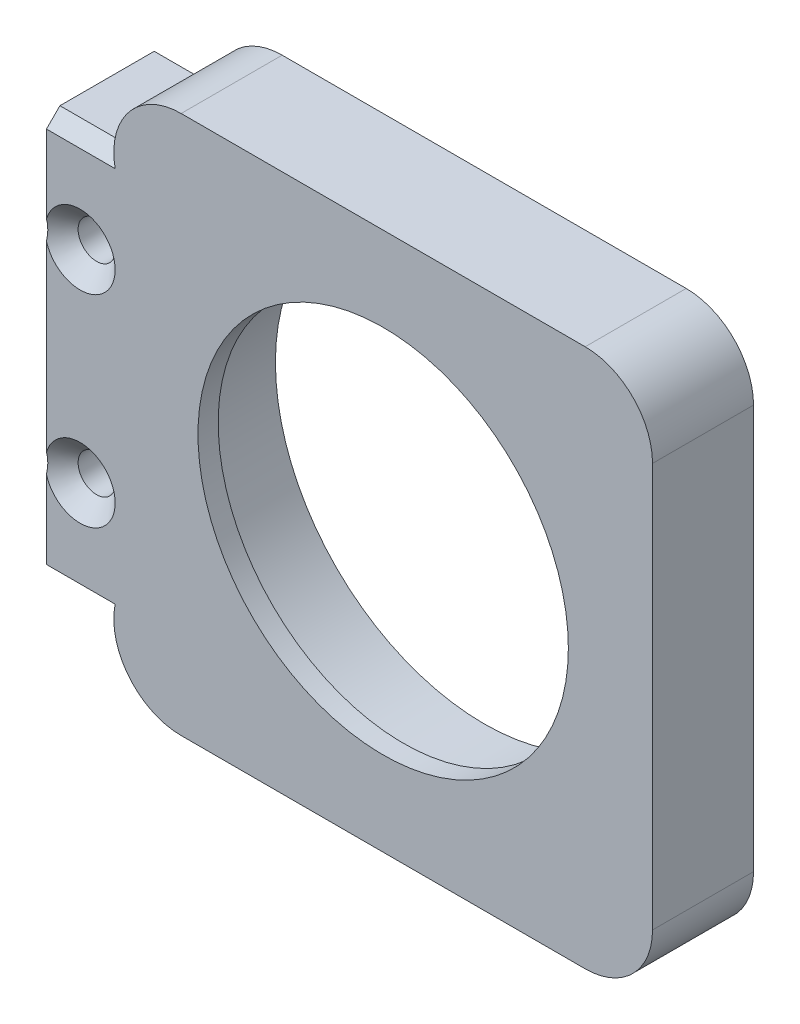
from build123d import *

# Parameters (mm, degrees)
SKETCH1_W                                       = 80
SKETCH1_H                                       = 80
BOSS_EXTRUDE1_DEPTH                             = 15
SKETCH2_R                                       = 31
CUT_EXTRUDE2_DEPTH                              = 115.127122105
SKETCH3_R                                       = 31
SKETCH3_R_2                                     = 27.5
BOSS_EXTRUDE2_DEPTH                             = 3
FILLET1_R                                       = 10
SKETCH5_W                                       = 10
SKETCH5_H                                       = 60
BOSS_EXTRUDE3_DEPTH                             = 20
SKETCH6_R                                       = 2.5
CUT_EXTRUDE3_DEPTH                              = 115.891252931
CHAMFER1_SIZE                                   = 2
CSK_FOR_M5_FLAT_HEAD_MACHINE_SCREW2_D           = 5.5
CSK_FOR_M5_FLAT_HEAD_MACHINE_SCREW2_CSINK_D     = 10.4
CSK_FOR_M5_FLAT_HEAD_MACHINE_SCREW2_CSINK_ANGLE = 90
CHAMFER2_SIZE                                   = 4
SKETCH11_R                                      = 15
CUT_EXTRUDE4_DEPTH                              = 2


with BuildPart() as part:
    # Sketch1 → Boss-Extrude1 (new body)
    with BuildSketch(Plane.XY):
        with Locations((40, 40)):
            Rectangle(SKETCH1_W, SKETCH1_H)
    extrude(amount=BOSS_EXTRUDE1_DEPTH)

    # Sketch2 → Cut-Extrude2 (cut, through all)
    with BuildSketch(Plane.XY.offset(15)):
        with Locations((40, 40)):
            Circle(SKETCH2_R)
    extrude(amount=-CUT_EXTRUDE2_DEPTH, mode=Mode.SUBTRACT)

    # Sketch3 → Boss-Extrude2 (add)
    with BuildSketch(Plane.XY.offset(15)):
        with Locations((40, 40)):
            Circle(SKETCH3_R)
        with Locations((40, 40)):
            Circle(SKETCH3_R_2, mode=Mode.SUBTRACT)
    extrude(amount=-BOSS_EXTRUDE2_DEPTH)

    # Fillet1
    fillet1_edges = [part.edges().sort_by_distance(p)[0] for p in [
        (80, 80, 7.5),
        (80, 0, 7.5),
        (0, 0, 7.5),
        (0, 80, 7.5),
    ]]
    fillet(fillet1_edges, radius=FILLET1_R)

    # Sketch5 → Boss-Extrude3 (add)
    with BuildSketch(Plane.XY.offset(15)):
        with Locations((-5, 40)):
            Rectangle(SKETCH5_W, SKETCH5_H)
    extrude(amount=-BOSS_EXTRUDE3_DEPTH)

    # Sketch6 → Cut-Extrude3 (cut, through all)
    with BuildSketch(Plane.XY.offset(15)):
        with Locations((-5, 55)):
            Circle(SKETCH6_R)
        with Locations((-5, 25)):
            Circle(SKETCH6_R)
    extrude(amount=-CUT_EXTRUDE3_DEPTH, mode=Mode.SUBTRACT)

    # Chamfer1
    chamfer1_edges = [part.edges().sort_by_distance(p)[0] for p in [
        (-5, 10, 15),
        (-5, 70, 15),
    ]]
    chamfer(chamfer1_edges, length=CHAMFER1_SIZE)

    # CSK for M5 Flat Head Machine Screw2 (through all)
    with Locations(Plane.XY.offset(15)):
        with Locations((-5, 55), (-5, 25)):
            CounterSinkHole(CSK_FOR_M5_FLAT_HEAD_MACHINE_SCREW2_D / 2, CSK_FOR_M5_FLAT_HEAD_MACHINE_SCREW2_CSINK_D / 2, counter_sink_angle=CSK_FOR_M5_FLAT_HEAD_MACHINE_SCREW2_CSINK_ANGLE)

    # Chamfer2
    chamfer2_edges = [part.edges().sort_by_distance(p)[0] for p in [
        (-5, 10, -5),
        (-5, 70, -5),
    ]]
    chamfer(chamfer2_edges, length=CHAMFER2_SIZE)

    # Sketch11 → Cut-Extrude4 (cut)
    with BuildSketch(Plane.ZY.offset(10)):
        with Locations((-15, 40)):
            Circle(SKETCH11_R)
    extrude(amount=-CUT_EXTRUDE4_DEPTH, mode=Mode.SUBTRACT)


solid = part.part
